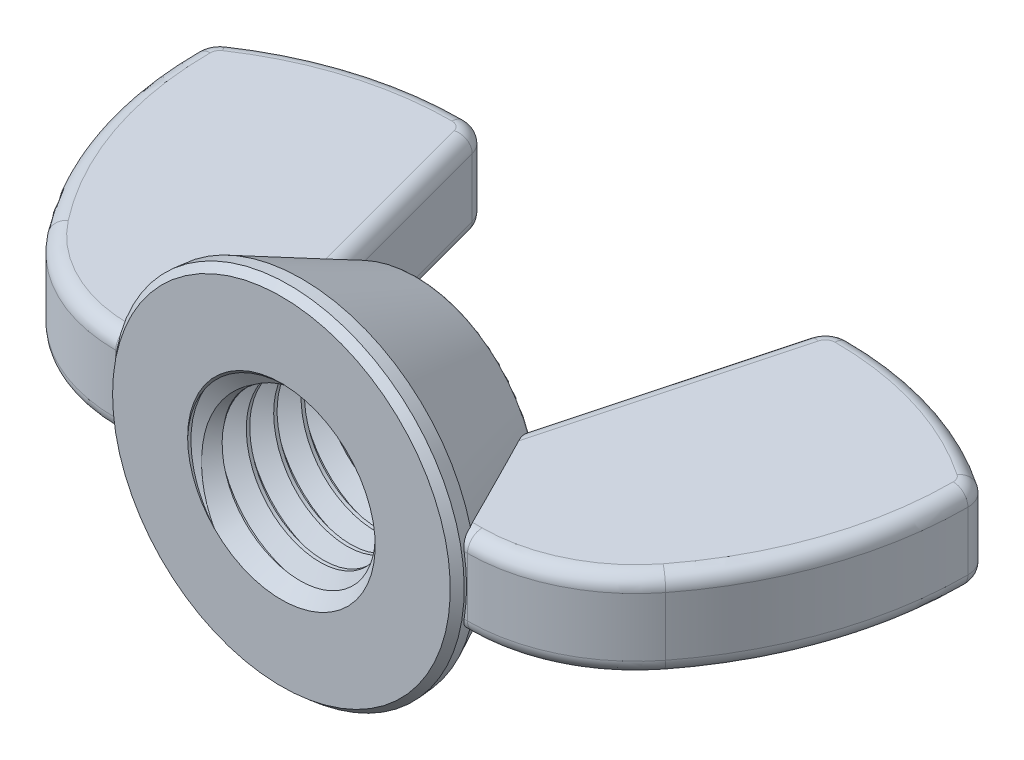
from build123d import *

# Parameters (mm, degrees)
EXTRUDE2_DEPTH     = 2.8125
SKETCH3_R          = 11.25
EXTRUDE1_DEPTH     = 1.3014
EXTRUDE1_DRAFT     = -5
SKETCH15_R         = 11.136142253
EXTRUDE3_DEPTH     = 7.3746
EXTRUDE3_TAPER     = 25.806554919
FILLET3_R          = 0.254
SKETCH4_R          = 6
CUT_EXTRUDE1_DEPTH = 37.296866256
SWEEP1_PITCH       = 1.75
SKETCH7_R          = 11.25
CUT_EXTRUDE2_DEPTH = 37.296866287
SKETCH8_R          = 11.136142253
CUT_EXTRUDE3_DEPTH = 32.217819883
SKETCH11_R         = 5.9492
CUT_EXTRUDE5_DEPTH = 32.217819847
CUT_EXTRUDE5_TAPER = 45
CHAMFER1_SIZE      = 0.488025
CHAMFER1_SIZE2     = 0.450477502
FILLET4_R          = 0.9375


with BuildPart() as part:
    # Sketch13 → Extrude2 (new, symmetric)
    with BuildSketch(Plane(origin=(0, 0, 0), x_dir=(1, 0, 0), z_dir=(0, 1, 0))):
        with BuildLine():
            Line((6.915544339, 0.6507), (11.25, 0.6507))
            ThreePointArc((11.25, 0.6507), (15.98772486, 1.747291496), (19.761809181, 4.814022212))
            ThreePointArc((19.761809181, 4.814022212), (23.431118572, 11.599273038), (24.7, 19.208044299))
            ThreePointArc((24.7, 19.208044299), (24.517105614, 19.941593616), (24.011238912, 20.503415506))
            ThreePointArc((24.011238912, 20.503415506), (18.398046584, 23.180770907), (12.247341102, 24.1))
            ThreePointArc((12.247341102, 24.1), (11.296151369, 23.777114594), (10.738081998, 22.941904758))
            Line((10.738081998, 22.941904758), (6.915544339, 8.676))
            Line((6.915544339, 8.676), (6.915544339, 0.6507))
        make_face()
    extrude(amount=EXTRUDE2_DEPTH, both=True)

    # Fillet4
    fillet4_edges = [part.edges().sort_by_distance(p)[0] for p in [
        (15.98772486, 2.8125, -1.747291496),
        (9.08277217, -2.8125, -0.6507),
        (23.431118572, 2.8125, -11.599273038),
        (24.517105614, 2.8125, -19.941593616),
        (18.398046584, 2.8125, -23.180770907),
        (11.296151369, 2.8125, -23.777114594),
        (8.826813169, 2.8125, -15.808952379),
        (9.08277217, 2.8125, -0.6507),
        (8.826813169, -2.8125, -15.808952379),
        (11.296151369, -2.8125, -23.777114594),
        (18.398046584, -2.8125, -23.180770907),
        (24.517105614, -2.8125, -19.941593616),
        (23.431118572, -2.8125, -11.599273038),
        (15.98772486, -2.8125, -1.747291496),
    ]]
    fillet(fillet4_edges, radius=FILLET4_R)


with BuildPart() as body_2:
    # Sketch3 → Extrude1 (with draft: the straight prism first)
    with BuildSketch(Plane.XY):
        Circle(SKETCH3_R)
    extrude(amount=-EXTRUDE1_DEPTH)
    # Extrude1: the draft: its side faces are tilted about the plane it starts from
    extrude1_sides = [body_2.faces().sort_by_distance(p)[0] for p in [
        (-11.25, 0, -0.6507),
    ]]
    draft(extrude1_sides, Plane.XY, EXTRUDE1_DRAFT)

    # Sketch15 → Extrude3 (add)
    with BuildSketch(Plane(origin=(0, 0, -1.3014), x_dir=(-1, 0, 0), z_dir=(0, 0, -1))):
        Circle(SKETCH15_R)
    extrude(amount=EXTRUDE3_DEPTH, taper=EXTRUDE3_TAPER)

    # Fillet3
    fillet3_edges = [body_2.edges().sort_by_distance(p)[0] for p in [
        (7.570080408, 0, -8.676),
    ]]
    fillet(fillet3_edges, radius=FILLET3_R)

    # Sketch4 → Cut-Extrude1 (cut, through all)
    with BuildSketch(Plane.XY):
        Circle(SKETCH4_R)
    extrude(amount=-CUT_EXTRUDE1_DEPTH, mode=Mode.SUBTRACT)

    # Sweep1: arcs per turn and ends read off the stored shape
    # Sweep1: the profile of Sketch6 profile screwed along a right-hand helix through 7 turns, 6 arcs to a turn; built about Z, then put on its axis
    sweep1_z = Axis((0, 0, 0), (0, 0, 1))
    sweep1_corners = [(6.0003, 0, -1.531423205), (4.863341658, 0, -0.875), (4.863341658, 0, -0.65625), (6.0003, 0, 0.000173205)]
    with BuildLine(mode=Mode.PRIVATE) as sweep1_profile:
        Line(sweep1_corners[0], sweep1_corners[1])
        Line(sweep1_corners[1], sweep1_corners[2])
        Line(sweep1_corners[2], sweep1_corners[3])
        Line(sweep1_corners[3], sweep1_corners[0])
    sweep1_cap = Face(sweep1_profile.wire())
    sweep1_turn_angles = [0, 30, 60, 90, 120, 150, 180, 210, 240, 270, 300, 330, 360]
    sweep1_turn_weights = [1, 0.8660254037844387, 1, 0.8660254037844387, 1, 0.8660254037844387, 1, 0.8660254037844387, 1, 0.8660254037844387, 1, 0.8660254037844387, 1]
    sweep1_turn_rails = [Edge.make_bspline([Vector(p[0], p[1], 0).rotate(sweep1_z, sweep1_turn_angles[k]) / sweep1_turn_weights[k] + Vector(0, 0, p[2] + SWEEP1_PITCH * sweep1_turn_angles[k] / 360) for k in range(13)], [0, 0, 0, 1, 1, 2, 2, 3, 3, 4, 4, 5, 5, 6, 6, 6], 2, sweep1_turn_weights) for p in sweep1_corners]
    sweep1_turn_sides = [Face.make_surface_from_curves(sweep1_turn_rails[p[0]], sweep1_turn_rails[p[1]]) for p in [(0, 1), (1, 2), (2, 3), (3, 0)]]
    sweep1_turn = Solid(Shell([*sweep1_turn_sides, sweep1_cap, sweep1_cap.rotate(sweep1_z, 360).moved(Location((0, 0, SWEEP1_PITCH * 360 / 360)))]))
    sweep1_each = [*[sweep1_turn.moved(Location((0, 0, SWEEP1_PITCH * i))) for i in range(7)]]
    add(Plane(origin=(0, 0, 0), x_dir=(-1, 0, 0), z_dir=(0, 0, -1)) * Compound([sweep1_each[i] for i in range(0, 7, 2)]))
    add(Plane(origin=(0, 0, 0), x_dir=(-1, 0, 0), z_dir=(0, 0, -1)) * Compound([sweep1_each[i] for i in range(1, 7, 2)]))

    # Sketch7 → Cut-Extrude2 (cut, through all)
    with BuildSketch(Plane.XY):
        Circle(SKETCH7_R)
    extrude(amount=CUT_EXTRUDE2_DEPTH, mode=Mode.SUBTRACT)

    # Sketch8 → Cut-Extrude3 (cut, through all)
    with BuildSketch(Plane.XY.offset(-8.676)):
        Circle(SKETCH8_R)
    extrude(amount=-CUT_EXTRUDE3_DEPTH, mode=Mode.SUBTRACT)

    # Cut-Extrude4 cone 1 section (through the dimple's axis) → Cut-Extrude4 (revolve, cut)
    with BuildSketch(Plane(origin=(0, 0, 0), x_dir=(0, -1, 0), z_dir=(1, 0, 0))):
        Polygon((0, 0), (6, 0), (0, 6), align=None)
    revolve(axis=Axis((0, 0, 0), (0, 0, -1)), mode=Mode.SUBTRACT)

    # Sketch11 → Cut-Extrude5 (cut, through all)
    with BuildSketch(Plane.XY.offset(-8.676)):
        Circle(SKETCH11_R)
    extrude(amount=CUT_EXTRUDE5_DEPTH, taper=CUT_EXTRUDE5_TAPER, mode=Mode.SUBTRACT)

    # Chamfer1
    chamfer1_edges = [body_2.edges().sort_by_distance(p)[0] for p in [
        (-11.25, 0, 0),
    ]]
    chamfer1_side = [body_2.faces().sort_by_distance(p)[0] for p in [
        (-11.193071127, 0, -0.6507),
    ]]
    chamfer(chamfer1_edges, length=CHAMFER1_SIZE, length2=CHAMFER1_SIZE2, reference=chamfer1_side[0])


with BuildPart() as body_3:
    # Mirror6: mirrored copy
    add(part.part.mirror(Plane(origin=(0, 0, 0), x_dir=(0, 0, 1), z_dir=(1, 0, 0))))

    # Combine2: union part, body 2
    add(part.part)
    add(body_2.part)


solid = body_3.part
